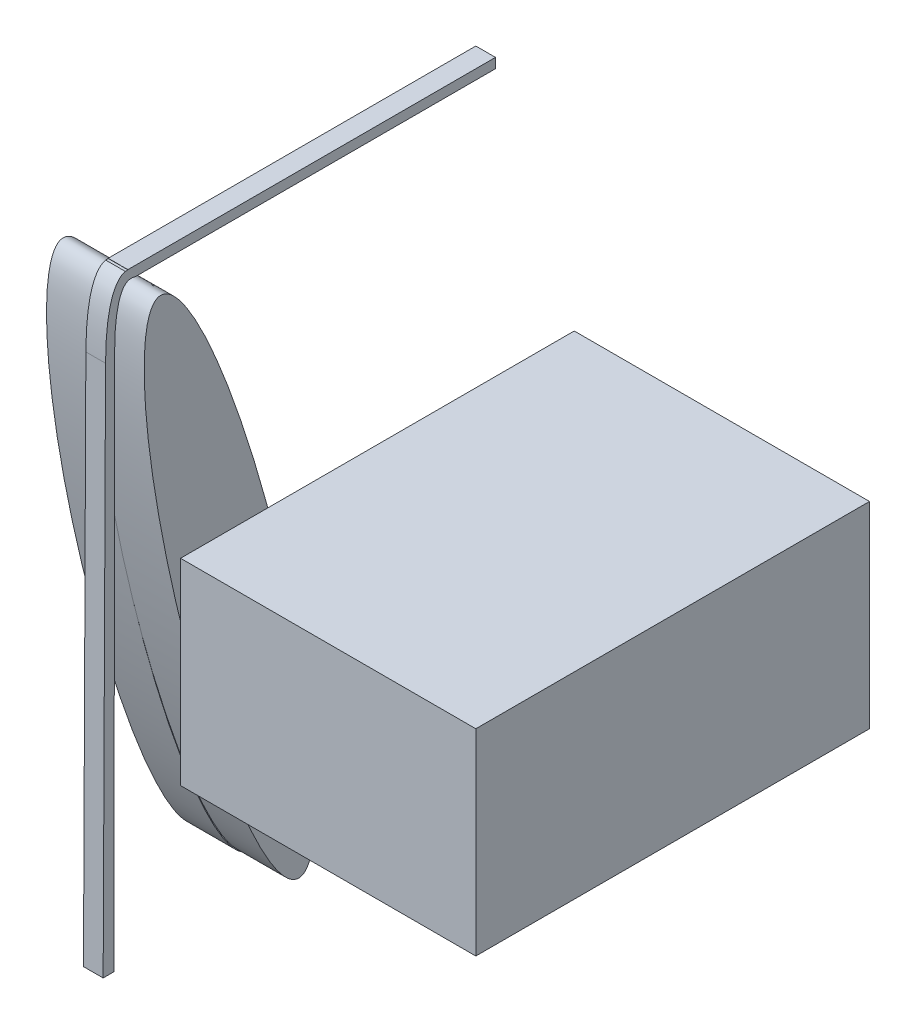
from build123d import *

# Parameters (mm, degrees)
SKETCH_1_W      = 30
SKETCH_1_H      = 20
EXTRUDE_1_DEPTH = 40
SKETCH_2_R      = 2
EXTRUDE_2_DEPTH = 5
SKETCH_3_RX     = 30
SKETCH_3_RY     = 5
EXTRUDE_3_DEPTH = 5
SKETCH_4_W      = 37.348500324
SKETCH_4_H      = 1
EXTRUDE_4_DEPTH = 2
EXTRUDE_START   = -2
EXTRUDE_5_DEPTH = 2
SKETCH_6_RX     = 29.994547564
SKETCH_6_RY     = 5.00002525
EXTRUDE_6_DEPTH = 5


# Read off the part's stored shape, not the designer's step: 凸台-拉伸5
with BuildPart() as part:
    # 草图1 → 凸台-拉伸1 (new body)
    with BuildSketch(Plane.XY):
        with Locations((15, 10)):
            Rectangle(SKETCH_1_W, SKETCH_1_H)
    extrude(amount=EXTRUDE_1_DEPTH)

    # 草图2 → 凸台-拉伸2 (add)
    with BuildSketch(Plane.ZY):
        with Locations(Location((30, 10, 0), (0, 0, 180))):
            Circle(SKETCH_2_R)
    extrude(amount=EXTRUDE_2_DEPTH)

    # 草图3 → 凸台-拉伸3 (add)
    with BuildSketch(Plane.ZY.offset(5)):
        with Locations(Location((30, 10), (0, 0, -103.92099691))):
            Ellipse(SKETCH_3_RX, SKETCH_3_RY)
    extrude(amount=EXTRUDE_3_DEPTH)

    # 草图4 → 凸台-拉伸4 (add)
    with BuildSketch(Plane.ZY.offset(10)):
        with Locations((18.674250162, 39.574648358)):
            Rectangle(SKETCH_4_W, SKETCH_4_H)
    extrude(amount=-EXTRUDE_4_DEPTH)

    # 凸台-拉伸5 outline → 凸台-拉伸5 (add)
    with BuildSketch(Plane.ZY.offset(10).offset(EXTRUDE_START)):
        with BuildLine():
            Line((39.862468471, -21), (39.619125683, 32.967296936))
            add(Edge.make_bspline(
                [(39.619125683, 32.967296936), (39.589392589, 39.561347803), (37.614649654, 40.050686248)],
                knots=[5.629361553, 5.629361553, 5.629361553, 6.283185307, 6.283185307, 6.283185307], degree=2, weights=[1, 0.947038516, 1]))
            Line((37.614649654, 40.050686248), (37.348500324, 40.050855796))
            Line((37.348500324, 40.050855796), (37.348500324, 39.074648358))
            add(Edge.make_bspline(
                [(38.697434301, 33.514015855), (38.694345199, 38.494694197), (37.348500324, 39.074648358)],
                knots=[5.657287765, 5.657287765, 5.657287765, 6.250122592, 6.250122592, 6.250122592], degree=2, weights=[0.790463711, 0.847402464, 0.984462923]))
            Line((38.697434301, 33.514015855), (38.765118588, -21))
            Line((38.765118588, -21), (39.862468471, -21))
        make_face()
    extrude(amount=EXTRUDE_5_DEPTH)

    # 草图6 → 凸台-拉伸6 (add)
    with BuildSketch(Plane.ZY.offset(10)):
        with Locations(Location((30, 10), (0, 0, -103.736326108))):
            Ellipse(SKETCH_6_RX, SKETCH_6_RY)
    extrude(amount=EXTRUDE_6_DEPTH)


solid = part.part
